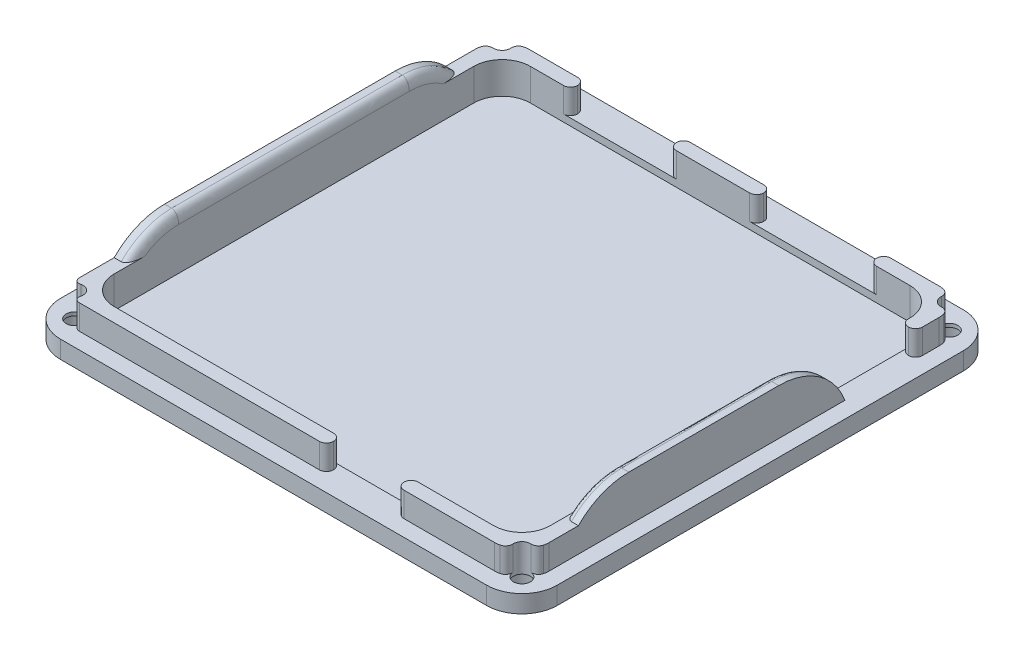
from build123d import *

# Parameters (mm, degrees)
AUFSATZ_LINEAR_AUSTRAGEN1_DEPTH                     = 2.5
VERRUNDUNG2_R                                       = 5
AUFSATZ_LINEAR_AUSTRAGEN2_DEPTH                     = 3.5
AUFSATZ_LINEAR_AUSTRAGEN2_DEPTH_BACK                = 2.5
CBORE_FOR_M2_HEX_SOCKET_HEAD_CAP_SCREW1_D           = 2.4
CBORE_FOR_M2_HEX_SOCKET_HEAD_CAP_SCREW1_CBORE_D     = 4.4
CBORE_FOR_M2_HEX_SOCKET_HEAD_CAP_SCREW1_CBORE_DEPTH = 2
CUT_EXTRUDE1_START                                  = -1
CUT_EXTRUDE1_DEPTH                                  = 1
FILLET2_R                                           = 3
SKETCH5_W                                           = 14.000000000000004
SKETCH5_H                                           = 6.000000000000025
SKETCH5_W_2                                         = 10.000000000000016
SKETCH5_H_2                                         = 2
CUT_EXTRUDE2_DEPTH                                  = 3.5
SKETCH6_W                                           = 2
SKETCH6_H                                           = 37.76000000000002
BOSS_EXTRUDE1_DEPTH                                 = 3
FILLET3_R                                           = 10
FILLET4_SIZE                                        = 1.5
FILLET4_SIZE_2                                      = 1
SKETCH7_R                                           = 3.3000000000000003
SKETCH7_R_2                                         = 3.300000000000001
CUT_EXTRUDE3_DEPTH                                  = 1
VERRUNDUNG6_R                                       = 1
VERRUNDUNG7_R                                       = 1


# Some blends are built 0.0001 mm under size
with BuildPart() as part:
    # Skizze1 → Aufsatz-Linear austragen1 (new body)
    with BuildSketch(Plane(origin=(0, 0, 0), x_dir=(1, 0, 0), z_dir=(0, 1, 0))):
        Polygon((-37.85689655172418, 30.22727586206897), (32.5181034482758, 30.22727586206897), (32.518103448275816, -37.33272413793104), (-37.85689655172418, -37.33272413793104), align=None)
    extrude(amount=AUFSATZ_LINEAR_AUSTRAGEN1_DEPTH)

    # Verrundung2
    verrundung2_edges = [part.edges().sort_by_distance(p)[0] for p in [
        (-37.85689655172418, 1.25, -30.22727586206897),
        (32.5181034482758, 1.25, -30.22727586206897),
        (32.518103448275816, 1.25, 37.33272413793104),
        (-37.85689655172418, 1.25, 37.33272413793104),
    ]]
    fillet(verrundung2_edges, radius=VERRUNDUNG2_R)

    # Skizze2 → Aufsatz-Linear austragen2 (add, two sides: drawn at the far end of the back side and taken through both)
    with BuildSketch(Plane(origin=(0, 2.5, 0), x_dir=(1, 0, 0), z_dir=(0, 1, 0)).offset(-AUFSATZ_LINEAR_AUSTRAGEN2_DEPTH_BACK)):
        Polygon((-35.55689655172418, 25.227275862068968), (-32.85689655172418, 27.92727586206897), (27.518103448275802, 27.92727586206897), (30.218103448275805, 25.227275862068964), (30.218103448275823, -32.33272413793104), (27.518103448275813, -35.03272413793104), (-32.85689655172418, -35.03272413793104), (-35.55689655172417, -32.33272413793104), align=None)
        with BuildLine():
            Line((24.218103448275794, 25.92727586206897), (-29.556896551724147, 25.92727586206897))
            ThreePointArc((-29.556896551724147, 25.92727586206897), (-32.385323676470364, 24.755702986815162), (-33.55689655172418, 21.927275862068942))
            Line((-33.55689655172418, 21.927275862068942), (-33.55689655172418, -29.032724137931012))
            ThreePointArc((-33.55689655172418, -29.032724137931012), (-32.38532367647037, -31.861151262677232), (-29.556896551724147, -33.03272413793104))
            Line((-29.556896551724147, -33.03272413793104), (24.218103448275794, -33.03272413793104))
            ThreePointArc((24.218103448275794, -33.03272413793104), (27.04653057302201, -31.86115126267723), (28.21810344827582, -29.032724137931012))
            Line((28.21810344827582, -29.032724137931012), (28.21810344827582, 21.927275862068942))
            ThreePointArc((28.21810344827582, 21.927275862068942), (27.04653057302201, 24.75570298681516), (24.218103448275794, 25.92727586206897))
        make_face(mode=Mode.SUBTRACT)
    extrude(amount=AUFSATZ_LINEAR_AUSTRAGEN2_DEPTH + AUFSATZ_LINEAR_AUSTRAGEN2_DEPTH_BACK)

    # CBORE for M2 Hex Socket Head Cap Screw1 (through all)
    with Locations(Plane(origin=(0, 0, 0), x_dir=(-1, 0, 0), z_dir=(0, -1, 0))):
        with Locations((34.356896552, -33.832724138), (-29.018103448, -33.832724138), (-29.018103448, 26.727275862), (34.356896552, 26.727275862)):
            CounterBoreHole(CBORE_FOR_M2_HEX_SOCKET_HEAD_CAP_SCREW1_D / 2, CBORE_FOR_M2_HEX_SOCKET_HEAD_CAP_SCREW1_CBORE_D / 2, CBORE_FOR_M2_HEX_SOCKET_HEAD_CAP_SCREW1_CBORE_DEPTH)

    # Sketch4 → Cut-Extrude1 (cut)
    with BuildSketch(Plane(origin=(0, 2.5, 0), x_dir=(1, 0, 0), z_dir=(0, 1, 0)).offset(CUT_EXTRUDE1_START)):
        with BuildLine():
            Line((-29.556896551724147, 25.92727586206897), (24.218103448275798, 25.927275862068974))
            ThreePointArc((24.218103448275798, 25.927275862068974), (27.046530573022014, 24.755702986815162), (28.218103448275823, 21.927275862068946))
            Line((28.218103448275823, 21.927275862068946), (28.218103448275826, -29.032724137931012))
            ThreePointArc((28.218103448275826, -29.032724137931012), (27.046530573022018, -31.861151262677232), (24.218103448275798, -33.03272413793104))
            Line((24.218103448275798, -33.03272413793104), (-29.55689655172414, -33.03272413793104))
            ThreePointArc((-29.55689655172414, -33.03272413793104), (-32.38532367647036, -31.861151262677232), (-33.55689655172417, -29.032724137931012))
            Line((-33.55689655172417, -29.032724137931012), (-33.55689655172418, 21.927275862068942))
            ThreePointArc((-33.55689655172418, 21.927275862068942), (-32.38532367647037, 24.755702986815162), (-29.556896551724147, 25.92727586206897))
        make_face()
    extrude(amount=CUT_EXTRUDE1_DEPTH, mode=Mode.SUBTRACT)

    # Fillet2
    # the kernel refuses this fillet: 3 mm, written as the material it takes off along each edge
    with BuildSketch(Plane(origin=(27.518103448275813, 8.914069690761654, 35.03272413793104), x_dir=(-1, 0, 0), z_dir=(0, -1, 0))) as fillet2_piece_1:
        with BuildLine():
            CenterArc((1.1656278763046615, 3), FILLET2_R, 235.93352329678598, 34.06647670321399)
            Line((-0.5148353453845331, 0.5148353453845402), (-0.5484446098183184, 0.4651320522922333))
            ThreePointArc((-0.5484446098183184, 0.4651320522922333), (-0.29984407956346004, 0.21499126582107664), (-0.04242640687119348, -0.04242640687119348))
            Line((-0.04242640687119348, -0.04242640687119348), (0, -0.06000000000000227))
            Line((0, -0.06000000000000227), (1.1656278763046615, -0.06000000000000227))
            Line((1.1656278763046615, -0.06000000000000227), (1.1656278763046615, 0))
        make_face()
    extrude(amount=6.414069690761654, mode=Mode.SUBTRACT)
    with BuildSketch(Plane(origin=(30.218103448275823, 8.914069691174408, 32.33272413793104), x_dir=(-0.7071067811865549, 0, 0.7071067811865402), z_dir=(0, -1, 0))) as fillet2_piece_2:
        with BuildLine():
            CenterArc((1.2970969677678281, 2.945543719351474), FILLET2_R, 224.9999999999994, 34.066476714969326)
            Line((-0.8242233757918364, 0.8242233757918535), (-0.8666497826630288, 0.781796968920662))
            Line((-0.8666497826630288, 0.781796968920662), (-0.04242640687119239, -0.04242640687119151))
            Line((-0.04242640687119239, -0.04242640687119151), (-6.2e-16, -0.06000000000000089))
            ThreePointArc((-6.2e-16, -0.06000000000000089), (0.3640435641597175, -0.06000000000000214), (0.7167069315304703, -0.05891087438703033))
            Line((0.7167069315304703, -0.05891087438703033), (0.7280871283194388, 0))
        make_face()
    extrude(amount=6.414069691174408, mode=Mode.SUBTRACT)
    with BuildSketch(Plane(origin=(30.218103448275805, 8.914069691077001, -25.227275862068964), x_dir=(0, 0, 1), z_dir=(0, -1, 0))) as fillet2_piece_3:
        with BuildLine():
            CenterArc((1.1656278764308006, 3), FILLET2_R, 235.93352328780463, 34.06647671219537)
            Line((-0.5148353456479526, 0.5148353456479597), (-0.548444610089529, 0.46513205256091794))
            ThreePointArc((-0.548444610089529, 0.46513205256091794), (-0.2998440796951698, 0.21499126595278284), (-0.04242640687119348, -0.04242640687119348))
            Line((-0.04242640687119348, -0.04242640687119348), (0, -0.05999999999999872))
            Line((0, -0.05999999999999872), (1.1656278764308006, -0.05999999999999872))
            Line((1.1656278764308006, -0.05999999999999872), (1.1656278764308006, 0))
        make_face()
    extrude(amount=6.414069691077001, mode=Mode.SUBTRACT)
    with BuildSketch(Plane(origin=(27.518103448275802, 8.914069690829404, -27.92727586206897), x_dir=(0.7071067811865402, 0, 0.7071067811865549), z_dir=(0, -1, 0))) as fillet2_piece_4:
        with BuildLine():
            CenterArc((1.2970969678654103, 2.9455437192538922), FILLET2_R, 224.9999999999994, 34.06647670514337)
            Line((-0.8242233756942545, 0.8242233756942716), (-0.8666497825654469, 0.7817969688230801))
            Line((-0.8666497825654469, 0.7817969688230801), (-0.04242640687119239, -0.04242640687119151))
            Line((-0.04242640687119239, -0.04242640687119151), (-6.2e-16, -0.06000000000000089))
            ThreePointArc((-6.2e-16, -0.06000000000000089), (0.36404356395592957, -0.06000000000000466), (0.7167069311128031, -0.05891087438507839))
            Line((0.7167069311128031, -0.05891087438507839), (0.7280871279118729, 0))
        make_face()
    extrude(amount=6.414069690829404, mode=Mode.SUBTRACT)
    with BuildSketch(Plane(origin=(-35.55689655172418, 2.5, -25.227275862068968), x_dir=(0, 0, 1), z_dir=(0, 1, 0))) as fillet2_piece_5:
        with BuildLine():
            CenterArc((1.1656278763224428, 3), FILLET2_R, 235.93352329551973, 34.06647670448024)
            Line((-0.5148353454216732, 0.5148353454216803), (-0.5484446098565563, 0.46513205233011234))
            ThreePointArc((-0.5484446098565563, 0.46513205233011234), (-0.2998440795820301, 0.21499126583964312), (-0.04242640687119348, -0.04242640687119348))
            Line((-0.04242640687119348, -0.04242640687119348), (0, -0.06000000000000227))
            Line((0, -0.06000000000000227), (1.1656278763224428, -0.06000000000000227))
            Line((1.1656278763224428, -0.06000000000000227), (1.1656278763224428, 0))
        make_face()
    extrude(amount=6.414069690806107, mode=Mode.SUBTRACT)
    with BuildSketch(Plane(origin=(-32.85689655172418, 8.914069691218906, -27.92727586206897), x_dir=(1, 0, 0), z_dir=(0, -1, 0))) as fillet2_piece_6:
        with BuildLine():
            CenterArc((1.1656278764875623, 3), FILLET2_R, 235.93352328376366, 34.066476716236366)
            Line((-0.5148353457664641, 0.5148353457664818), (-0.548444610211547, 0.4651320526818097))
            ThreePointArc((-0.548444610211547, 0.4651320526818097), (-0.29984407975442906, 0.21499126601204566), (-0.04242640687119348, -0.04242640687119348))
            Line((-0.04242640687119348, -0.04242640687119348), (0, -0.05999999999999872))
            Line((0, -0.05999999999999872), (1.1656278764875623, -0.05999999999999872))
            Line((1.1656278764875623, -0.05999999999999872), (1.1656278764875623, 0))
        make_face()
    extrude(amount=6.414069691218906, mode=Mode.SUBTRACT)

    # Sketch5 → Cut-Extrude2 (cut)
    with BuildSketch(Plane(origin=(0, 6, 0), x_dir=(1, 0, 0), z_dir=(0, 1, 0))):
        Polygon((2.5181034482758164, 25.92727586206897), (18.51810344827582, 25.92727586206897), (18.51810344827582, 27.92727586206897), (2.51810344827582, 27.92727586206897), align=None)
        with Locations((-16.856896551724176, 24.927275862068953)):
            Rectangle(SKETCH5_W, SKETCH5_H)
        with Locations((7.518103448275817, -34.03272413793104)):
            Rectangle(SKETCH5_W_2, SKETCH5_H_2)
        Polygon((30.218103448275823, 20.72727586206897), (21.63239567050676, 20.727275862068968), (21.63239567050676, 10.72727586206897), (30.218103448275823, 10.72727586206897), align=None)
    extrude(amount=-CUT_EXTRUDE2_DEPTH, mode=Mode.SUBTRACT)

    # Sketch6 → Boss-Extrude1 (add)
    with BuildSketch(Plane(origin=(0, 6, 0), x_dir=(1, 0, 0), z_dir=(0, 1, 0))):
        with Locations((29.218103448275823, -8.152724137931035)):
            Rectangle(SKETCH6_W, SKETCH6_H)
        Polygon((-33.55689655172418, -27.032724137931044), (-35.55689655172418, -27.032724137931044), (-35.55689655172418, 19.927275862068967), (-33.55689655172418, 19.92727586206897), align=None)
    extrude(amount=BOSS_EXTRUDE1_DEPTH)

    # Fillet3
    # the kernel refuses this fillet: 10 mm, written as the material it takes off along each edge
    with BuildSketch(Plane(origin=(-15.703325480367056, 9, 27.032724137931044), x_dir=(0, 0, -1), z_dir=(-1, 0, 0))) as fillet3_piece_1:
        with BuildLine():
            CenterArc((7.141428428542849, 10), FILLET3_R, 224.42700400080568, 45.57299599919429)
            Line((0, 3), (-0.1428285685708559, 2.8600000000000003))
            ThreePointArc((-0.1428285685708559, 2.8600000000000003), (-0.1999999999999993, 1.5), (-0.1999999999999993, 0))
            Line((-0.1999999999999993, 0), (0, -0.1999999999999993))
            Line((0, -0.1999999999999993), (7.141428428542849, -0.1999999999999993))
            Line((7.141428428542849, -0.1999999999999993), (7.141428428542849, 0))
        make_face()
    extrude(amount=37.70714214271425, mode=Mode.SUBTRACT)
    with BuildSketch(Plane(origin=(48.07167451963295, 9, 27.032724137931044), x_dir=(0, -1, 0), z_dir=(-1, 0, 0))) as fillet3_piece_2:
        with BuildLine():
            CenterArc((10, -7.141428428542849), FILLET3_R, 134.4270040008057, 45.57299599919429)
            Line((0, -7.141428428542849), (-0.1999999999999993, -7.141428428542849))
            Line((-0.1999999999999993, -7.141428428542849), (-0.1999999999999993, 0))
            Line((-0.1999999999999993, 0), (0, 0.1999999999999993))
            ThreePointArc((0, 0.1999999999999993), (1.5, 0.1999999999999993), (2.8600000000000003, 0.1428285685708559))
            Line((2.8600000000000003, 0.1428285685708559), (3, 0))
        make_face()
    extrude(amount=37.707142142714254, mode=Mode.SUBTRACT)
    with BuildSketch(Plane(origin=(-53.4104676230813, 9, -19.927275862068935), x_dir=(0, -1, 0), z_dir=(1, 0, -1.78e-15))) as fillet3_piece_3:
        with BuildLine():
            CenterArc((10, -7.14142842854285), FILLET3_R, 134.4270040008057, 45.57299599919429)
            Line((0, -7.14142842854285), (-0.1999999999999993, -7.14142842854285))
            Line((-0.1999999999999993, -7.14142842854285), (-0.1999999999999993, 0))
            Line((-0.1999999999999993, 0), (0, 0.1999999999999993))
            ThreePointArc((0, 0.1999999999999993), (1.5, 0.1999999999999993), (2.8600000000000003, 0.1428285685708559))
            Line((2.8600000000000003, 0.1428285685708559), (3, 0))
        make_face()
    extrude(amount=37.70714214271425, mode=Mode.SUBTRACT)
    with BuildSketch(Plane(origin=(4.799360954281816, 9, -10.727275862068973), x_dir=(0, 0, 1), z_dir=(1, 0, 0))) as fillet3_piece_4:
        with BuildLine():
            CenterArc((9.367496997597602, 10), FILLET3_R, 200.48731511472266, 69.51268488527734)
            Line((3.55e-15, 6.5), (-0.18734993995194849, 6.43))
            ThreePointArc((-0.18734993995194849, 6.43), (-0.19999999999999574, 3.25), (-0.1999999999999993, 0))
            Line((-0.1999999999999993, 0), (0, -0.1999999999999993))
            Line((0, -0.1999999999999993), (9.367496997597602, -0.1999999999999993))
            Line((9.367496997597602, -0.1999999999999993), (9.367496997597602, 0))
        make_face()
    extrude(amount=48.83748498798801, mode=Mode.SUBTRACT)

    # Fillet4
    # a fillet whose section is not a circle: 1.5, 1 mm, written as the material it takes off along each edge
    with BuildSketch(Plane(origin=(28.21810344827582, -1, -1.359778864471), x_dir=(0, 1, -1.6e-16), z_dir=(0, 1.6e-16, 1))) as fillet4_piece_1_section:
        with BuildLine():
            Bezier((10 - FILLET4_SIZE, 0), (10, 0), (10, -FILLET4_SIZE_2), weights=[1, 0.7071067811865476, 1])
            Line((10, -FILLET4_SIZE_2), (10, 0))
            Line((10, 0), (10 - FILLET4_SIZE, 0))
        make_face()
    fillet4_piece_1 = revolve(axis=Axis((28.21810344827582, -1, -1.359778864471), (-1, 0, 0)), revolution_arc=91.0037504380081, mode=Mode.PRIVATE)
    fillet4_piece_1 = split(fillet4_piece_1, bisect_by=Plane(origin=(28.21810344827582, 2.5, -1.359778864471), z_dir=(0, 1, 0)), keep=Keep.TOP, mode=Mode.PRIVATE)
    add(fillet4_piece_1, mode=Mode.SUBTRACT)
    with BuildSketch(Plane(origin=(28.21810344827582, -1, 19.891295709388004), x_dir=(0, 1, 0), z_dir=(0, 0, -1))) as fillet4_piece_2_section:
        with BuildLine():
            Bezier((10.000000000000002 - FILLET4_SIZE, 0), (10, 0), (10, FILLET4_SIZE_2), weights=[1, 0.7071067811865476, 1])
            Line((10, FILLET4_SIZE_2), (10.000000000000002, 0))
            Line((10.000000000000002, 0), (10.000000000000002 - FILLET4_SIZE, 0))
        make_face()
    fillet4_piece_2 = revolve(axis=Axis((28.21810344827582, -1, 19.891295709388004), (1, 0, 0)), revolution_arc=67.06112592162275, mode=Mode.PRIVATE)
    fillet4_piece_2 = split(fillet4_piece_2, bisect_by=Plane(origin=(28.21810344827582, 6, 19.891295709388004), z_dir=(0, 1, 0)), keep=Keep.TOP, mode=Mode.PRIVATE)
    add(fillet4_piece_2, mode=Mode.SUBTRACT)
    with BuildSketch(Plane(origin=(28.21810344827582, 9, 19.891295709388004), x_dir=(0, -1, 0), z_dir=(0, 0, -1))) as fillet4_piece_3:
        with BuildLine():
            Bezier((FILLET4_SIZE, 0), (0, 0), (0, -FILLET4_SIZE_2), weights=[1, 0.7071067811865476, 1])
            Line((0, -FILLET4_SIZE_2), (0, 0))
            Line((0, 0), (FILLET4_SIZE, 0))
        make_face()
    extrude(amount=21.251074573859004, mode=Mode.SUBTRACT)
    with BuildSketch(Plane(origin=(-33.55689655172418, -1, 19.891295709388004), x_dir=(0, 1, 3.6e-16), z_dir=(0, 3.6e-16, -1))) as fillet4_piece_4_section:
        with BuildLine():
            Bezier((10, -FILLET4_SIZE_2), (10.000000000000002, 0), (10.000000000000002 - FILLET4_SIZE, 0), weights=[1, 0.7071067811865476, 1])
            Line((10.000000000000002 - FILLET4_SIZE, 0), (10.000000000000002, 0))
            Line((10.000000000000002, 0), (10, -FILLET4_SIZE_2))
        make_face()
    fillet4_piece_4 = revolve(axis=Axis((-33.55689655172418, -1, 19.891295709388004), (1, 0, 0)), revolution_arc=67.06112592162272, mode=Mode.PRIVATE)
    fillet4_piece_4 = split(fillet4_piece_4, bisect_by=Plane(origin=(-33.55689655172418, 6, 19.891295709388004), z_dir=(0, 1, 0)), keep=Keep.TOP, mode=Mode.PRIVATE)
    add(fillet4_piece_4, mode=Mode.SUBTRACT)
    with BuildSketch(Plane(origin=(-33.55689655172418, -1, -12.785847433526), x_dir=(0, 1, 1.8e-16), z_dir=(0, -1.8e-16, 1))) as fillet4_piece_5_section:
        with BuildLine():
            Bezier((10.000000000000002, FILLET4_SIZE_2), (10.000000000000002, 0), (10.000000000000002 - FILLET4_SIZE, 0), weights=[1, 0.7071067811865476, 1])
            Line((10.000000000000002 - FILLET4_SIZE, 0), (10.000000000000002, 0))
            Line((10.000000000000002, 0), (10.000000000000002, FILLET4_SIZE_2))
        make_face()
    fillet4_piece_5 = revolve(axis=Axis((-33.55689655172418, -1, -12.785847433526), (-1, 0, 0)), revolution_arc=67.06112592162275, mode=Mode.PRIVATE)
    fillet4_piece_5 = split(fillet4_piece_5, bisect_by=Plane(origin=(-33.55689655172418, 6, -12.785847433526), z_dir=(0, 1, 0)), keep=Keep.TOP, mode=Mode.PRIVATE)
    add(fillet4_piece_5, mode=Mode.SUBTRACT)
    with BuildSketch(Plane(origin=(-33.55689655172418, 9, -12.785847433525998), x_dir=(-1, 0, 0), z_dir=(0, 0, 1))) as fillet4_piece_6:
        with BuildLine():
            Bezier((FILLET4_SIZE_2, 0), (0, 0), (0, FILLET4_SIZE), weights=[1, 0.7071067811865476, 1])
            Line((0, FILLET4_SIZE), (0, 0))
            Line((0, 0), (FILLET4_SIZE_2, 0))
        make_face()
    extrude(amount=32.677143142914, mode=Mode.SUBTRACT)

    # Sketch7 → Cut-Extrude3 (cut)
    with BuildSketch(Plane.XZ):
        with Locations(Location((-27.856896551724173, 32.332724137931045, 0), (0, 0, 270))):
            Circle(SKETCH7_R)
        with Locations(Location((22.518103448275816, 32.332724137931045, 0), (0, 0, 270))):
            Circle(SKETCH7_R)
        with Locations(Location((-27.856896551724173, -25.227275862068968, 0), (0, 0, 270))):
            Circle(SKETCH7_R_2)
        with Locations(Location((22.518103448275816, -25.227275862068968, 0), (0, 0, 270))):
            Circle(SKETCH7_R_2)
    extrude(amount=-CUT_EXTRUDE3_DEPTH, mode=Mode.SUBTRACT)

    # Verrundung6
    verrundung6_edges = [part.edges().sort_by_distance(p)[0] for p in [
        (-23.856896551724176, 4.25, -27.92727586206897),
        (-23.856896551724176, 4.25, -25.92727586206897),
        (-33.37173189749065, 4.25, -27.412440516302496),
        (-35.042061206302506, 4.25, -25.742111207490645),
        (2.5181034482758093, 4.25, 33.03272413793104),
        (2.5181034482758093, 4.25, 35.03272413793104),
        (12.518103448275825, 4.25, 33.03272413793104),
        (12.518103448275825, 4.25, 35.03272413793104),
        (29.70326810254651, 4.25, 32.847559483660355),
        (28.03293879366035, 4.25, 34.51788879254651),
        (28.032938793716923, 4.25, -27.41244051662785),
        (29.703268102627852, 4.25, -25.74211120771692),
        (28.21810344827582, 4.25, -20.727275862068968),
        (30.218103448275823, 4.25, -20.72727586206897),
        (18.51810344827582, 4.25, -25.92727586206897),
        (18.51810344827582, 4.25, -27.92727586206897),
        (-9.856896551724173, 4.25, -27.92727586206897),
        (2.51810344827582, 4.25, -27.92727586206897),
        (2.5181034482758164, 4.25, -25.92727586206897),
        (-9.856896551724173, 4.25, -25.92727586206897),
        (-35.55689655172417, 4.25, 32.33272413793104),
        (-32.85689655172418, 4.25, 35.03272413793104),
    ]]
    fillet(verrundung6_edges, radius=VERRUNDUNG6_R - 0.0001)  # a hair under: the kernel refuses the full size

    # Verrundung7
    # the kernel refuses this fillet: 1 mm, written as the material it takes off along each edge
    with BuildSketch(Plane(origin=(-35.04206120622114, 2.5, 32.84755948343406), x_dir=(0.9105519664799712, 0, -0.41339462543610495), z_dir=(0, 1, 0))) as verrundung7_piece_1:
        with BuildLine():
            CenterArc((0.6137460413732296, 0.9835724992628225), VERRUNDUNG7_R, 223.60590698457656, 35.99441944466042)
            Line((-0.11035471897193931, 0.29387829973121254), (0, 0))
            ThreePointArc((0, 0), (0.21661624989643344, 0.01971300088461262), (0.43323249979287626, 1e-17))
        make_face()
    extrude(amount=4.58308124948219, mode=Mode.SUBTRACT)
    with BuildSketch(Plane(origin=(-33.37173189743407, 2.5, 34.51788879222115), x_dir=(0.7071067811867059, 0, 0.707106781186389), z_dir=(0, 1, 0))) as verrundung7_piece_2:
        with BuildLine():
            CenterArc((0.7050343276877846, 0.920339970638663), VERRUNDUNG7_R, 210.98141456157046, 35.994419464040845)
            ThreePointArc((-0.15229999446940362, 0.4055799682576791), (-0.0576952453893808, 0.2097199580524793), (0, 0))
            Line((0, 0), (0.31391498727513667, 0))
        make_face()
    extrude(amount=4.583081249743298, mode=Mode.SUBTRACT)


solid = part.part
